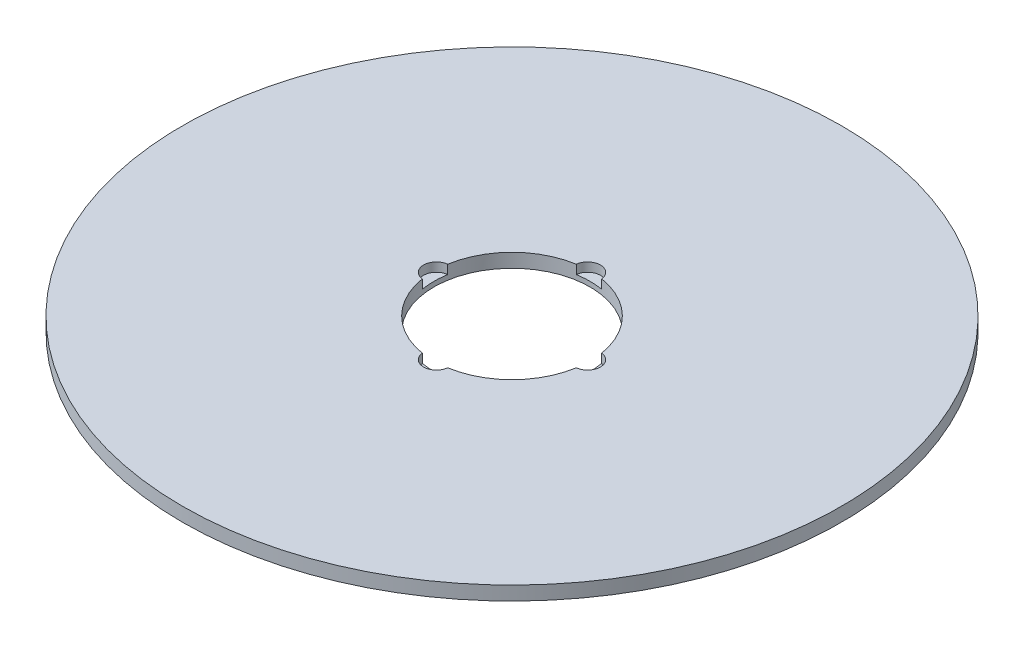
from build123d import *

# Parameters (mm, degrees)
SKETCH1_R           = 95
BOSS_EXTRUDE1_DEPTH = 4
SKETCH2_R           = 22.5
CUT_EXTRUDE1_DEPTH  = 135.40982107
SKETCH3_R           = 3.689687082
CUT_EXTRUDE2_DEPTH  = 2.586189552
CIRPATTERN1_COUNT   = 4


with BuildPart() as part:
    # Sketch1 → Boss-Extrude1 (new body)
    with BuildSketch(Plane(origin=(0, 0, 0), x_dir=(1, 0, 0), z_dir=(0, 1, 0))):
        Circle(SKETCH1_R)
    extrude(amount=BOSS_EXTRUDE1_DEPTH)

    # Sketch2 → Cut-Extrude1 (cut, through all)
    with BuildSketch(Plane(origin=(0, 0, 0), x_dir=(1, 0, 0), z_dir=(0, 1, 0))):
        Circle(SKETCH2_R)
    extrude(amount=CUT_EXTRUDE1_DEPTH, mode=Mode.SUBTRACT)

    # Sketch3 → Cut-Extrude2 (cut)
    with BuildSketch(Plane(origin=(0, 4, 0), x_dir=(1, 0, 0), z_dir=(0, 1, 0))):
        with Locations((-21.791834608, 0)):
            Circle(SKETCH3_R)
    cut_extrude2 = extrude(amount=-CUT_EXTRUDE2_DEPTH, mode=Mode.SUBTRACT)

    # CirPattern1: Cut-Extrude2 ×4 about axis
    cirpattern1_axis = Axis((0, 0, 0), (0, 1, 0))
    for i in range(1, CIRPATTERN1_COUNT):
        add(cut_extrude2.rotate(cirpattern1_axis, i * 360 / CIRPATTERN1_COUNT), mode=Mode.SUBTRACT)


solid = part.part
